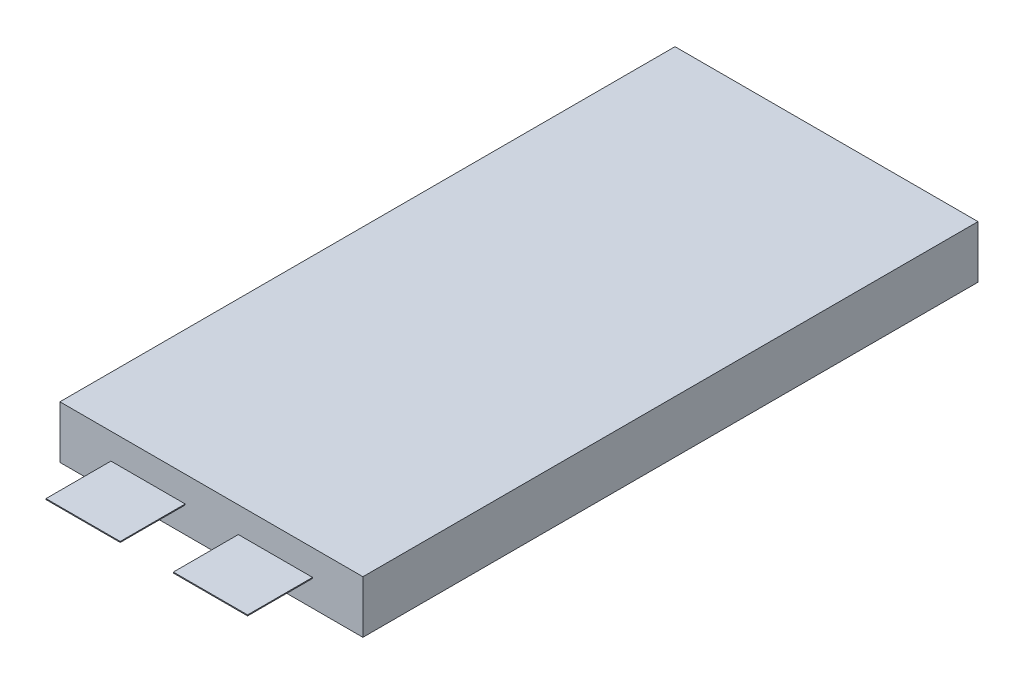
from build123d import *

# Parameters (mm, degrees)
SKETCH1_W           = 32.66
SKETCH1_H           = 5.66
BOSS_EXTRUDE1_DEPTH = 66.3
BOSS_EXTRUDE3_DEPTH = 7
F_3DSKETCH2_R       = 3.086177745
F_3DSKETCH2_R_2     = 2.932442158
CUT_EXTRUDE1_DEPTH  = 0.1


with BuildPart() as part:
    # Sketch1 → Boss-Extrude1 (new body)
    with BuildSketch(Plane.XY):
        with Locations((-4.344198718, -1.121650641)):
            Rectangle(SKETCH1_W, SKETCH1_H)
    extrude(amount=BOSS_EXTRUDE1_DEPTH)


with BuildPart() as boss_extrude3_tool:
    # 3DSketch1 → Boss-Extrude3 (new, along a direction that is not the sketch's normal)
    with BuildSketch(Plane(origin=(-15.174198718, -1.178373292, 66.3), x_dir=(0.9999872662359682, 0.005046520163970641, -3.866762069669127e-07), z_dir=(-4.534508681961708e-07, 1.3230678756319878e-05, -0.9999999999123718))):
        Polygon((0, 0), (7.99989813, 0.040372161), (8.000402782, -0.059626565), (0.000504652, -0.099998727), align=None)
        Polygon((13.729853573, 0.063545778), (21.729762739, 0.101958696), (21.730277042, 0), (13.730369262, -0.038412192), align=None)
    extrude(amount=-BOSS_EXTRUDE3_DEPTH, dir=(0, 0, -1))


with BuildPart() as part_1:
    add(part.part)


with BuildPart() as part_2:
    # Boss-Extrude3: joined with boss_extrude3_tool
    add(part_1.part.fuse(boss_extrude3_tool.part, tol=0.00001))

    # 3DSketch2 → Cut-Extrude1 (cut)
    # profile 1 of 2: a face of its own
    with BuildSketch(Plane(origin=(-14.000400956, -3.951650641, 62.768913979), x_dir=(0.9972629704452686, 0, 0.07393624130749163), z_dir=(0, 1, 0))):
        with Locations((2.573415081, 0)):
            Circle(F_3DSKETCH2_R)
        with Locations((2.573415081, 0)):
            Circle(F_3DSKETCH2_R_2, mode=Mode.SUBTRACT)
    # profile 2 of 2: a face of its own
    with BuildSketch(Plane(origin=(-14.000400956, -3.951650641, 62.768913979), x_dir=(0.9972629704452686, 0, 0.07393624130749163), z_dir=(0, 1, 0))):
        Polygon((0, 0), (5.118694666, 0.379495735), (5.146830162, 0), (0.028135496, -0.379495735), align=None)
    extrude(amount=CUT_EXTRUDE1_DEPTH, mode=Mode.SUBTRACT)


solid = part_2.part
